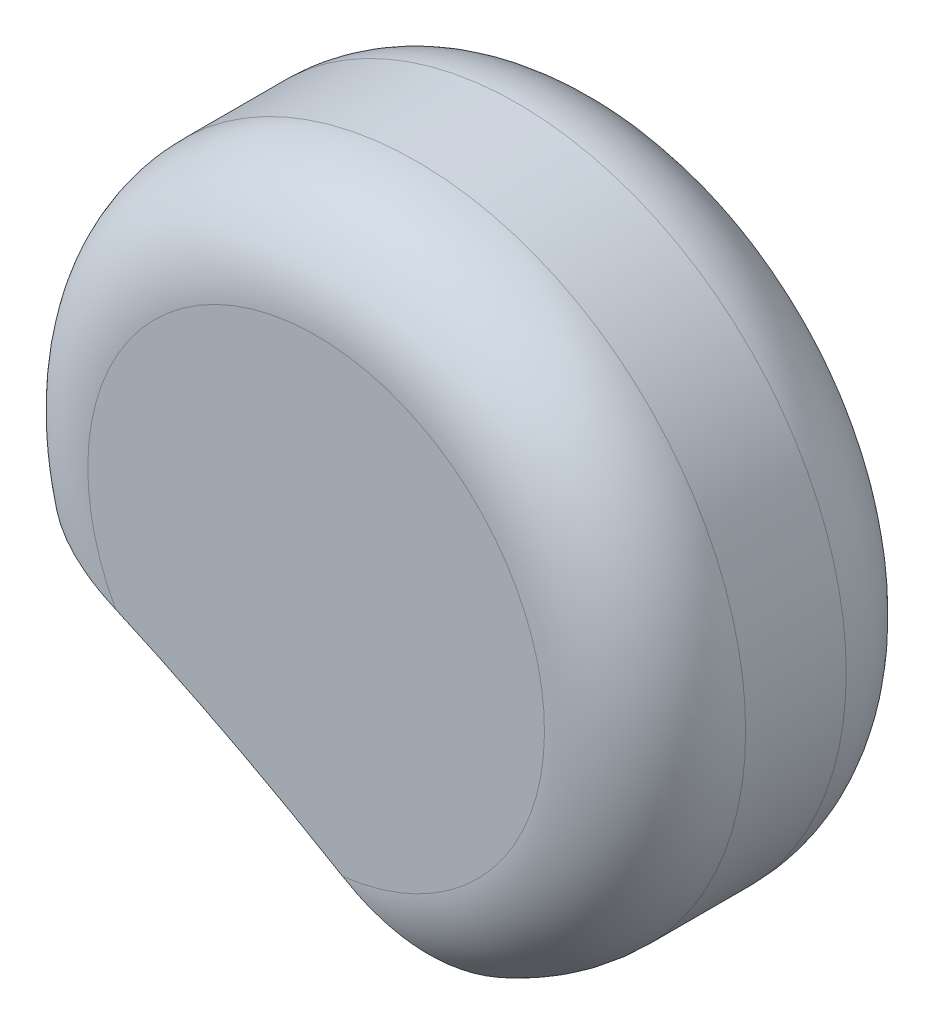
from build123d import *

# Parameters (mm, degrees)
BOSS_EXTRUDE1_DEPTH = 30
CUT_EXTRUDE1_DEPTH  = 168.969030848
FILLET1_R           = 10
SCALE1_SCALE        = 1.3


# Read off the part's stored shape, not the designer's step: Shell1
with BuildPart() as part:
    # Sketch2 → Boss-Extrude1 (new body)
    with BuildSketch(Plane.XY):
        with BuildLine():
            Line((45.331903799, 79.981721463), (84.494599506, 60.509010482))
            ThreePointArc((84.494599506, 60.509010482), (90.297722371, 121.297543733), (45.331903799, 79.981721463))
        make_face()
    extrude(amount=BOSS_EXTRUDE1_DEPTH)

    # Sketch1 → Cut-Extrude1 (cut, through all)
    with BuildSketch(Plane.XY):
        with BuildLine():
            Line((-207.427585228, -70.816904485), (207.427585228, -70.816904485))
            add(Edge.make_bspline(
                [(207.427585228, -70.816904485), (204.719066948, -65.719933317), (201.889284, -60.700830274), (196.005550807, -50.806569556), (192.95154063, -45.931450365), (186.630337337, -36.318103923), (183.363114107, -31.579896009), (178.306227152, -24.572790452), (176.59454614, -22.253817483), (173.119221553, -17.649238456), (171.357984458, -15.36687097), (162.448047194, -4.070630162), (154.977877241, 4.616336839), (139.33989427, 21.276715632), (131.172732428, 29.250793453), (118.332718452, 40.609198621), (113.9538723, 44.294237763), (104.977272116, 51.440415225), (100.379648275, 54.901686704), (94.476316855, 59.06840944), (93.286942563, 59.894303876), (90.898833506, 61.524704561), (89.699573736, 62.329601355), (86.085758046, 64.712548426), (83.655181384, 66.258886343), (76.295465833, 70.763325644), (71.298682083, 73.58752698), (61.096833898, 78.823647149), (55.891976191, 81.235975187), (47.897968668, 84.484861265), (45.202058186, 85.505982488), (41.10604398, 86.934438682), (39.732002669, 87.393363058), (36.965468503, 88.274687789), (35.572885995, 88.69702827), (28.603154069, 90.700325233), (22.973694214, 91.968362661), (11.588466497, 93.717046441), (5.832869932, 94.198760634), (0, 94.198760634)],
                knots=[0, 0, 0, 0, 0.0625, 0.0625, 0.125, 0.125, 0.1875, 0.1875, 0.21875, 0.21875, 0.25, 0.25, 0.375, 0.375, 0.5, 0.5, 0.5625, 0.5625, 0.625, 0.625, 0.640625, 0.640625, 0.65625, 0.65625, 0.6875, 0.6875, 0.75, 0.75, 0.8125, 0.8125, 0.84375, 0.84375, 0.859375, 0.859375, 0.875, 0.875, 0.9375, 0.9375, 1, 1, 1, 1], degree=3))
            add(Edge.make_bspline(
                [(0, 94.198760634), (-5.820884241, 94.198760634), (-11.585134477, 93.718569751), (-20.1609329, 92.399872662), (-23.007705214, 91.86002632), (-27.261450694, 90.91109362), (-28.674084664, 90.572084497), (-31.47973914, 89.853463721), (-32.874272147, 89.473518662), (-39.807767526, 87.476345761), (-45.229994007, 85.568698392), (-55.870207421, 81.245289543), (-61.087946097, 78.828910441), (-68.783431921, 74.878131536), (-71.326646661, 73.50660424), (-76.371978809, 70.661306303), (-78.862258303, 69.194210034), (-86.23920808, 64.67349259), (-91.034638137, 61.499665526), (-100.413779162, 54.875535956), (-104.997346241, 51.425045551), (-113.975082954, 44.276738239), (-118.369171937, 40.57881601), (-126.982947787, 32.955226848), (-131.203273049, 29.02883372), (-139.47622644, 20.963360848), (-143.503896937, 16.84871123), (-155.28186699, 4.275116318), (-162.72953679, -4.411659437), (-176.861100549, -22.360208604), (-183.544936364, -31.62202579), (-192.972439212, -45.965136136), (-196.014638257, -50.821683765), (-201.885870563, -60.695257816), (-204.714974123, -65.712231316), (-207.427585228, -70.816904485)],
                knots=[0, 0, 0, 0, 0.0625, 0.0625, 0.09375, 0.09375, 0.109375, 0.109375, 0.125, 0.125, 0.1875, 0.1875, 0.25, 0.25, 0.28125, 0.28125, 0.3125, 0.3125, 0.375, 0.375, 0.4375, 0.4375, 0.5, 0.5, 0.5625, 0.5625, 0.625, 0.625, 0.75, 0.75, 0.875, 0.875, 0.9375, 0.9375, 1, 1, 1, 1], degree=3))
        make_face()
    extrude(amount=CUT_EXTRUDE1_DEPTH, mode=Mode.SUBTRACT)

    # Fillet1
    fillet1_edges = [part.edges().sort_by_distance(p)[0] for p in [
        (90.698153357, 121.095000517, 0),
        (90.698153357, 121.095000517, 30),
    ]]
    fillet(fillet1_edges, radius=FILLET1_R)


with BuildPart() as part_1:
    # Scale1: scaled about (77.570400206, 95.559844129, 14.99998931)
    add(part.part.scale(SCALE1_SCALE).moved(Location((-23.271120062, -28.667953239, -4.499996793))))

    # Shell1 outline → Shell1 (revolve, cut)
    with BuildSketch(Plane(origin=(75.188633701, 90.953080219, 0), x_dir=(1, 0, 0), z_dir=(0, -1, 0))):
        with BuildLine():
            Line((37.51169924, 8.499999927), (37.51169924, 21.499999927))
            ThreePointArc((37.51169924, 21.499999927), (35.168553489, 27.156854176), (29.51169924, 29.499999927))
            Line((29.51169924, 29.499999927), (0, 29.499999927))
            Line((0, 29.499999927), (0, 0.499999927))
            Line((0, 0.499999927), (29.51169924, 0.499999927))
            ThreePointArc((29.51169924, 0.499999927), (35.168553489, 2.843145677), (37.51169924, 8.499999927))
        make_face()
    revolve(axis=Axis((75.188633701, 90.953080219, 0), (0, 0, 1)), mode=Mode.SUBTRACT)


solid = part_1.part
